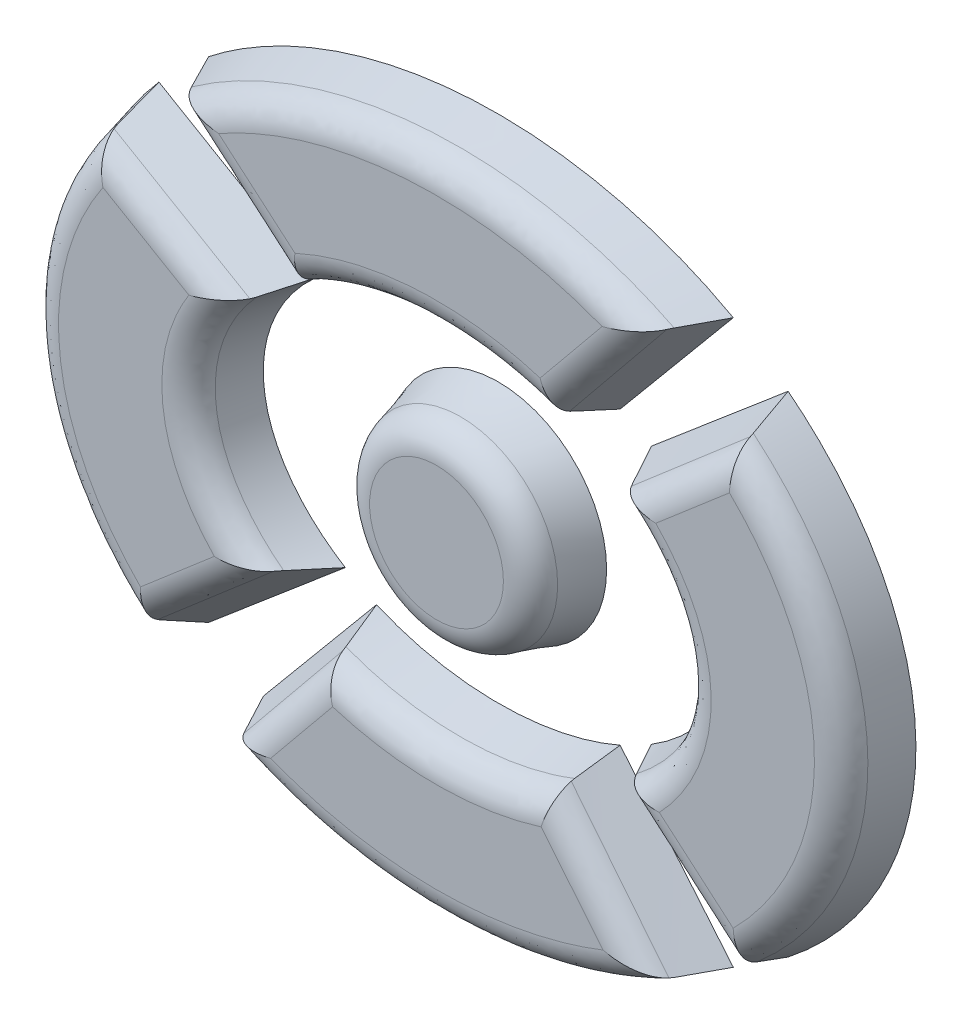
from build123d import *

# Parameters (mm, degrees)
FILLET_1_R = 1
FILLET_5_R = 1
FILLET_6_R = 1
FILLET_7_R = 1
FILLET_8_R = 1


with BuildPart() as part:
    # 放样3: read off the stored shape, not the designer's step
    # 放样3: loft between two sections, ruled curve by curve
    loft_3_from = [
        Edge.make_bspline([(15.509835694, 37.317274476, 0), (20.875286742, 41.813043048, 0), (16.37951817, 47.178494096, 0), (11.014067122, 42.682725524, 0), (5.648616074, 38.186956952, 0), (10.144384647, 32.821505904, 0), (15.509835694, 37.317274476, 0)], [0, 0, 0, 0, 0.5, 0.5, 0.5, 1, 1, 1, 1], 3, [1, 0.333333333, 0.333333333, 1, 0.333333333, 0.333333333, 1]),
    ]
    loft_3_to = [
        Edge.make_bspline([(15.907937309, 38.586225403, 2), (18.735486504, 43.878197204, 2), (13.443514702, 46.705746399, 2), (10.615965507, 41.413774597, 2), (7.788416313, 36.121802796, 2), (13.080388114, 33.294253601, 2), (15.907937309, 38.586225403, 2)], [0, 0, 0, 0, 0.5, 0.5, 0.5, 1, 1, 1, 1], 3, [1, 0.333333333, 0.333333333, 1, 0.333333333, 0.333333333, 1]),
    ]
    loft_3 = Solid(Shell([*[Face.make_surface_from_curves(loft_3_from[k], loft_3_to[k]) for k in range(1)], Face(Wire(loft_3_from)), Face(Wire(loft_3_to))]))
    add(loft_3)

    # 圆角1
    fillet_1_edges = [part.edges().sort_by_distance(p)[0] for p in [
        (10.615965507, 41.413774597, 2),
    ]]
    fillet(fillet_1_edges, radius=FILLET_1_R)


with BuildPart() as body_2:
    # 草图8 → 放样4 section 0
    with BuildSketch(Plane.XY):
        with BuildLine():
            Line((17.198198057, 44.704835875), (20.857174884, 49.093953198))
            add(Edge.make_bspline(
                [(20.857174884, 49.093953198), (11.790503571, 54.121470191), (3.893841129, 47.920423734)],
                knots=[4.114850547, 4.114850547, 4.114850547, 5.479327478, 5.479327478, 5.479327478], degree=2, weights=[1, 0.77616324, 1]))
            Line((3.893841129, 47.920423734), (8.313410451, 44.174343417))
            add(Edge.make_bspline(
                [(17.198198057, 44.704835875), (12.490390489, 46.767624477), (8.313410451, 44.174343417)],
                knots=[1.026370293, 1.026370293, 1.026370293, 2.279860526, 2.279860526, 2.279860526], degree=2, weights=[1, 0.809940822, 1]))
        make_face()
    # 草图9 → 放样4 section 1
    with BuildSketch(Plane.XY.offset(2)):
        with BuildLine():
            Line((16.7830815, 45.403430444), (19.7737567, 49.08775501))
            add(Edge.make_bspline(
                [(19.7737567, 49.08775501), (11.966328662, 52.737350062), (5.001075127, 48.10747373)],
                knots=[4.187741304, 4.187741304, 4.187741304, 5.400982773, 5.400982773, 5.400982773], degree=2, weights=[1, 0.821579205, 1]))
            Line((5.001075127, 48.10747373), (8.667824612, 44.941579083))
            add(Edge.make_bspline(
                [(16.7830815, 45.403430444), (12.544300858, 46.91903503), (8.667824612, 44.941579083)],
                knots=[4.262675613, 4.262675613, 4.262675613, 5.315462087, 5.315462087, 5.315462087], degree=2, weights=[1, 0.864624793, 1]))
        make_face()
    loft()

    # 圆角7
    fillet_7_edges = [body_2.edges().sort_by_distance(p)[0] for p in [
        (12.677742941, 45.98437382, 2),
        (6.83444987, 46.524526406, 2),
        (12.259147776, 50.468713866, 2),
        (18.2784191, 47.245592727, 2),
    ]]
    fillet(fillet_7_edges, radius=FILLET_7_R)


with BuildPart() as body_3:
    # 草图12 → 放样5 section 0
    with BuildSketch(Plane.XY):
        with BuildLine():
            Line((18.210492365, 35.825656583), (22.630061687, 32.079576266))
            add(Edge.make_bspline(
                [(22.630061687, 32.079576266), (32.71624844, 40), (22.630061687, 47.920423734)],
                knots=[2.337734825, 2.337734825, 2.337734825, 3.945450482, 3.945450482, 3.945450482], degree=2, weights=[1, 0.693934095, 1]))
            Line((22.630061687, 47.920423734), (18.210492365, 44.174343417))
            add(Edge.make_bspline(
                [(18.210492365, 35.825656583), (24.934078709, 40), (18.210492365, 44.174343417)],
                knots=[5.42145318, 5.42145318, 5.42145318, 7.144917435, 7.144917435, 7.144917435], degree=2, weights=[1, 0.65112381, 1]))
        make_face()
    # 草图13 → 放样5 section 1
    with BuildSketch(Plane.XY.offset(2)):
        with BuildLine():
            Line((19.440343427, 36.11994145), (23.001428901, 33.045277777))
            add(Edge.make_bspline(
                [(23.001428901, 33.045277777), (30.779383657, 40.151080985), (22.815339463, 47.121115625)],
                knots=[2.41763552, 2.41763552, 2.41763552, 3.886905148, 3.886905148, 3.886905148], degree=2, weights=[1, 0.742075593, 1]))
            Line((22.815339463, 47.121115625), (19.248632187, 44.041598052))
            add(Edge.make_bspline(
                [(19.440343427, 36.11994145), (24.045104662, 40.143189049), (19.248632187, 44.041598052)],
                knots=[2.438373584, 2.438373584, 2.438373584, 3.880661072, 3.880661072, 3.880661072], degree=2, weights=[1, 0.75105107, 1]))
        make_face()
    loft()

    # 圆角8
    fillet_8_edges = [body_3.edges().sort_by_distance(p)[0] for p in [
        (21.220886164, 34.582609613, 2),
        (26.26103321, 40.124793838, 2),
        (21.031985825, 45.581356839, 2),
        (21.360184535, 40.125314925, 2),
    ]]
    fillet(fillet_8_edges, radius=FILLET_8_R)


with BuildPart() as body_4:
    # 草图14 → 放样6 section 0
    with BuildSketch(Plane.XY):
        with BuildLine():
            Line((7.341839563, 43.448890637), (2.288139518, 46.406820682))
            add(Edge.make_bspline(
                [(2.288139518, 46.406820682), (-4.508518478, 38.677733734), (3.893841129, 32.079576266)],
                knots=[5.661460297, 5.661460297, 5.661460297, 7.087043136, 7.087043136, 7.087043136], degree=2, weights=[1, 0.756539382, 1]))
            Line((3.893841129, 32.079576266), (8.313410451, 35.825656583))
            add(Edge.make_bspline(
                [(7.341839563, 43.448890637), (2.722873543, 39.296545443), (8.313410451, 35.825656583)],
                knots=[5.605397912, 5.605397912, 5.605397912, 7.144917435, 7.144917435, 7.144917435], degree=2, weights=[1, 0.718077888, 1]))
        make_face()
    # 草图15 → 放样6 section 1
    with BuildSketch(Plane.XY.offset(2)):
        with BuildLine():
            Line((6.309475486, 43.078584691), (2.182375932, 45.492486289))
            add(Edge.make_bspline(
                [(2.182375932, 45.492486289), (-2.870974667, 38.842427833), (3.554631529, 33.016009233)],
                knots=[5.73270818, 5.73270818, 5.73270818, 7.010869245, 7.010869245, 7.010869245], degree=2, weights=[1, 0.80264452, 1]))
            Line((3.554631529, 33.016009233), (7.116496479, 36.09134591))
            add(Edge.make_bspline(
                [(6.309475486, 43.078584691), (3.316373368, 39.36970808), (7.116496479, 36.09134591)],
                knots=[5.744395703, 5.744395703, 5.744395703, 6.992669279, 6.992669279, 6.992669279], degree=2, weights=[1, 0.81146788, 1]))
        make_face()
    loft()

    # 圆角6
    fillet_6_edges = [body_4.edges().sort_by_distance(p)[0] for p in [
        (4.245925709, 44.28553549, 2),
        (0.322519453, 38.987609753, 2),
        (5.335564004, 34.553677571, 2),
        (5.199623317, 39.422001111, 2),
    ]]
    fillet(fillet_6_edges, radius=FILLET_6_R)


with BuildPart() as body_5:
    # 草图17 → 放样7 section 0
    with BuildSketch(Plane.XY):
        with BuildLine():
            Line((17.198198057, 35.295164125), (20.857174884, 30.906046802))
            add(Edge.make_bspline(
                [(5.666727932, 30.906046802), (13.261951408, 26.694455385), (20.857174884, 30.906046802)],
                knots=[0.973257893, 0.973257893, 0.973257893, 2.16833476, 2.16833476, 2.16833476], degree=2, weights=[1, 0.826723018, 1]))
            Line((5.666727932, 30.906046802), (9.325704759, 35.295164125))
            add(Edge.make_bspline(
                [(9.325704759, 35.295164125), (13.261951408, 33.570445218), (17.198198057, 35.295164125)],
                knots=[4.167962947, 4.167962947, 4.167962947, 5.256815014, 5.256815014, 5.256815014], degree=2, weights=[1, 0.855424705, 1]))
        make_face()
    # 草图16 → 放样7 section 1
    with BuildSketch(Plane.XY.offset(2)):
        with BuildLine():
            Line((16.830430177, 34.613640188), (19.81807082, 30.933054006))
            add(Edge.make_bspline(
                [(6.738020978, 30.917919954), (13.283499474, 27.850612643), (19.81807082, 30.933054006)],
                knots=[1.045070668, 1.045070668, 1.045070668, 2.099387018, 2.099387018, 2.099387018], degree=2, weights=[1, 0.864240222, 1]))
            Line((6.738020978, 30.917919954), (9.727860054, 34.601214469))
            add(Edge.make_bspline(
                [(9.727860054, 34.601214469), (13.283236602, 33.324188401), (16.830430177, 34.613640188)],
                knots=[1.119305374, 1.119305374, 1.119305374, 2.027010835, 2.027010835, 2.027010835], degree=2, weights=[1, 0.898764619, 1]))
        make_face()
    loft()

    # 圆角5
    fillet_5_edges = [body_5.edges().sort_by_distance(p)[0] for p in [
        (13.280233198, 34.000015282, 2),
        (18.324250499, 32.773347097, 2),
        (13.279736133, 29.500009826, 2),
        (8.232940516, 32.759567211, 2),
    ]]
    fillet(fillet_5_edges, radius=FILLET_5_R)


solid = Compound([part.part, body_2.part, body_3.part, body_4.part, body_5.part])
